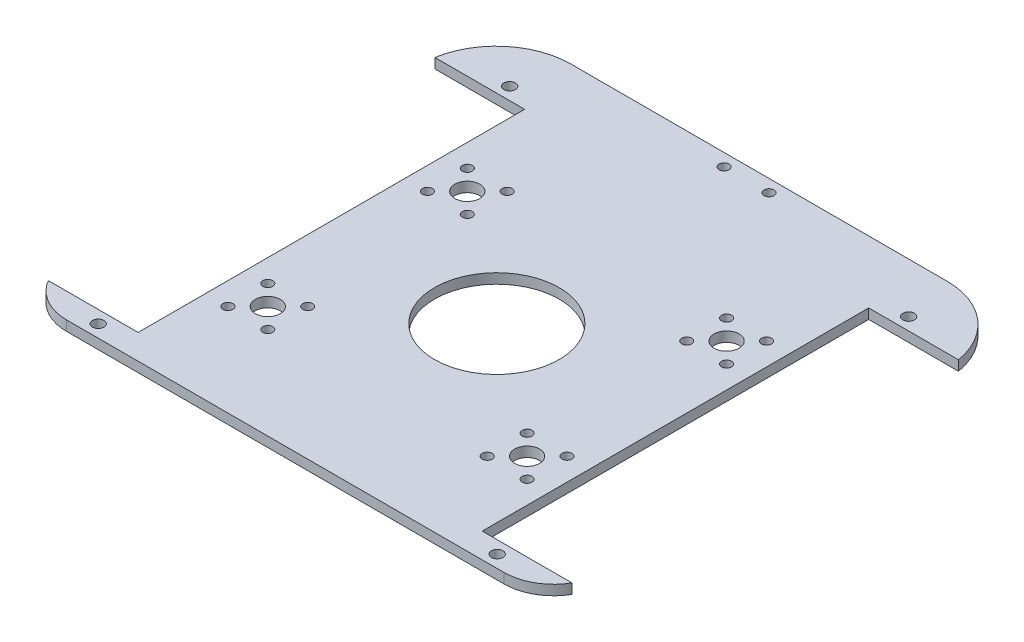
from build123d import *

# Parameters (mm, degrees)
SKETCH1_R           = 25
SKETCH1_R_2         = 2
SKETCH1_R_3         = 2.32
SKETCH1_R_4         = 5
BOSS_EXTRUDE1_DEPTH = 4
FILLET1_R           = 30
FILLET2_R           = 20


with BuildPart() as part:
    # Sketch1 → Boss-Extrude1 (new body)
    with BuildSketch(Plane(origin=(0, 0, 0), x_dir=(1, 0, 0), z_dir=(0, 1, 0))):
        Polygon((-153.14810061, 80), (-117.14810061, 80), (-117.14810061, -75), (-153.14810061, -75), (-153.14810061, -85), (56.85189939, -85), (56.85189939, -75), (20.85189939, -75), (20.85189939, 80), (56.85189939, 80), (56.85189939, 105), (-153.14810061, 105), align=None)
        with Locations(Location((-48.295998841, 0.000104161, 0), (0, 0, 270))):
            Circle(SKETCH1_R, mode=Mode.SUBTRACT)
        with Locations(Location((-57.14810061, 100, 0), (0, 0, 270))):
            Circle(SKETCH1_R_2, mode=Mode.SUBTRACT)
        with Locations(Location((-39.14810061, 100, 0), (0, 0, 90))):
            Circle(SKETCH1_R_2, mode=Mode.SUBTRACT)
        with Locations(Location((-128.14810061, -80, 0), (0, 0, 270))):
            Circle(SKETCH1_R_3, mode=Mode.SUBTRACT)
        with Locations(Location((-128.14810061, 85, 0), (0, 0, 90))):
            Circle(SKETCH1_R_3, mode=Mode.SUBTRACT)
        with Locations(Location((31.85189939, 85, 0), (0, 0, 270))):
            Circle(SKETCH1_R_3, mode=Mode.SUBTRACT)
        with Locations(Location((31.85189939, -80, 0), (0, 0, 90))):
            Circle(SKETCH1_R_3, mode=Mode.SUBTRACT)
        with Locations(Location((-108.14810061, -48, 0), (0, 0, 270))):
            Circle(SKETCH1_R_2, mode=Mode.SUBTRACT)
        with Locations(Location((-92.14810061, -48, 0), (0, 0, 270))):
            Circle(SKETCH1_R_2, mode=Mode.SUBTRACT)
        with Locations(Location((-92.14810061, -32, 0), (0, 0, 90))):
            Circle(SKETCH1_R_2, mode=Mode.SUBTRACT)
        with Locations(Location((-108.14810061, -32, 0), (0, 0, 90))):
            Circle(SKETCH1_R_2, mode=Mode.SUBTRACT)
        with Locations(Location((-100.14810061, -40, 0), (0, 0, 270))):
            Circle(SKETCH1_R_4, mode=Mode.SUBTRACT)
        with Locations(Location((-92.14810061, 48, 0), (0, 0, 90))):
            Circle(SKETCH1_R_2, mode=Mode.SUBTRACT)
        with Locations(Location((-108.14810061, 48, 0), (0, 0, 90))):
            Circle(SKETCH1_R_2, mode=Mode.SUBTRACT)
        with Locations(Location((-92.14810061, 32, 0), (0, 0, 270))):
            Circle(SKETCH1_R_2, mode=Mode.SUBTRACT)
        with Locations(Location((-100.14810061, 40, 0), (0, 0, 90))):
            Circle(SKETCH1_R_4, mode=Mode.SUBTRACT)
        with Locations(Location((-108.14810061, 32, 0), (0, 0, 270))):
            Circle(SKETCH1_R_2, mode=Mode.SUBTRACT)
        with Locations(Location((-4.14810061, -32, 0), (0, 0, 270))):
            Circle(SKETCH1_R_2, mode=Mode.SUBTRACT)
        with Locations(Location((-4.14810061, -48, 0), (0, 0, 90))):
            Circle(SKETCH1_R_2, mode=Mode.SUBTRACT)
        with Locations(Location((3.85189939, -40, 0), (0, 0, 90))):
            Circle(SKETCH1_R_4, mode=Mode.SUBTRACT)
        with Locations(Location((11.85189939, -48, 0), (0, 0, 90))):
            Circle(SKETCH1_R_2, mode=Mode.SUBTRACT)
        with Locations(Location((11.85189939, -32, 0), (0, 0, 270))):
            Circle(SKETCH1_R_2, mode=Mode.SUBTRACT)
        with Locations(Location((-4.14810061, 32, 0), (0, 0, 90))):
            Circle(SKETCH1_R_2, mode=Mode.SUBTRACT)
        with Locations(Location((-4.14810061, 48, 0), (0, 0, 270))):
            Circle(SKETCH1_R_2, mode=Mode.SUBTRACT)
        with Locations(Location((11.85189939, 32, 0), (0, 0, 90))):
            Circle(SKETCH1_R_2, mode=Mode.SUBTRACT)
        with Locations(Location((11.85189939, 48, 0), (0, 0, 270))):
            Circle(SKETCH1_R_2, mode=Mode.SUBTRACT)
        with Locations(Location((3.85189939, 40, 0), (0, 0, 270))):
            Circle(SKETCH1_R_4, mode=Mode.SUBTRACT)
    extrude(amount=BOSS_EXTRUDE1_DEPTH)

    # Fillet1
    # the kernel refuses this fillet: 30 mm, written as the material it takes off along each edge
    with BuildSketch(Plane(origin=(56.85189939, -73.950997289, -105), x_dir=(0, 0, 1), z_dir=(0, 1, 0))) as fillet1_piece_1:
        with BuildLine():
            CenterArc((30, -29.580398915), FILLET1_R, 99.594068227, 80.405931773)
            Line((0, -29.580398916), (-0.6, -29.580398916))
            Line((-0.6, -29.580398916), (-0.6, 0))
            Line((-0.6, 0), (0, 0.6))
            ThreePointArc((0, 0.6), (12.5, 0.6), (24.9, 0.591607978))
            Line((24.9, 0.591607978), (25, 0))
        make_face()
    extrude(amount=151.901994578, mode=Mode.SUBTRACT)
    with BuildSketch(Plane(origin=(-153.14810061, -73.950997289, -105), x_dir=(1, 0, 0), z_dir=(0, 1, 0))) as fillet1_piece_2:
        with BuildLine():
            CenterArc((29.580398916, -30), FILLET1_R, 90, 80.405931773)
            Line((0, -25), (-0.591607978, -24.9))
            ThreePointArc((-0.591607978, -24.9), (-0.6, -12.5), (-0.6, 0))
            Line((-0.6, 0), (0, 0.6))
            Line((0, 0.6), (29.580398916, 0.6))
            Line((29.580398916, 0.6), (29.580398916, 0))
        make_face()
    extrude(amount=151.901994578, mode=Mode.SUBTRACT)

    # Fillet2
    # the kernel refuses this fillet: 20 mm, written as the material it takes off along each edge
    with BuildSketch(Plane(origin=(56.85189939, -43.301270189, 85), x_dir=(0, 0, -1), z_dir=(0, 1, 0))) as fillet2_piece_1:
        with BuildLine():
            CenterArc((20, 17.320508076), FILLET2_R, 180, 60)
            Line((0, 17.320508076), (-0.4, 17.320508076))
            Line((-0.4, 17.320508076), (-0.4, 0))
            Line((-0.4, 0), (0, -0.4))
            ThreePointArc((0, -0.4), (5, -0.4), (9.8, -0.346410162))
            Line((9.8, -0.346410162), (10, 0))
        make_face()
    extrude(amount=90.602540378, mode=Mode.SUBTRACT)
    with BuildSketch(Plane(origin=(-153.14810061, -43.301270189, 85), x_dir=(1, 0, 0), z_dir=(0, 1, 0))) as fillet2_piece_2:
        with BuildLine():
            CenterArc((17.320508076, 20), FILLET2_R, 210, 60)
            Line((0, 10), (-0.346410162, 9.8))
            ThreePointArc((-0.346410162, 9.8), (-0.4, 5), (-0.4, 0))
            Line((-0.4, 0), (0, -0.4))
            Line((0, -0.4), (17.320508076, -0.4))
            Line((17.320508076, -0.4), (17.320508076, 0))
        make_face()
    extrude(amount=90.602540378, mode=Mode.SUBTRACT)


solid = part.part
